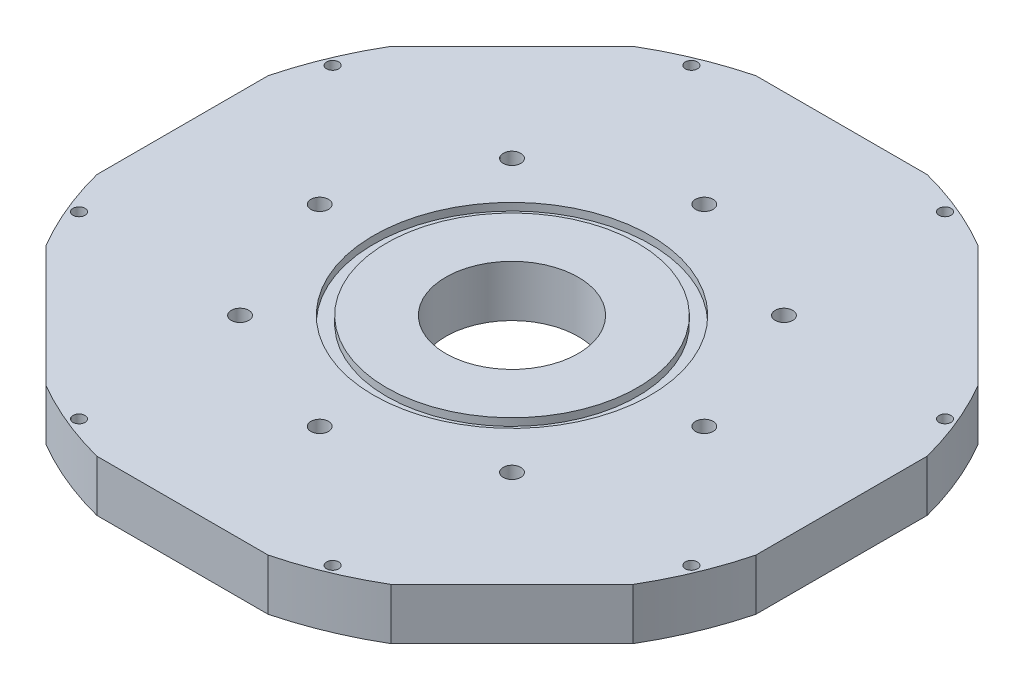
from build123d import *

# Parameters (mm, degrees)
BOSS_EXTRUDE1_DEPTH = 19.05
SKETCH3_R           = 24.5745
CUT_EXTRUDE1_DEPTH  = 175.004260005
SKETCH5_R           = 51.3715
SKETCH5_R_2         = 46.5455
CUT_EXTRUDE2_DEPTH  = 2.794
SKETCH19_R          = 2.2479
CUT_EXTRUDE4_DEPTH  = 175.004260005
CIRPATTERN2_COUNT   = 8
SKETCH37_R          = 119.0625
SKETCH37_R_2        = 115.2525
CUT_EXTRUDE7_DEPTH  = 2.667
CIRPATTERN4_COUNT   = 8


with BuildPart() as part:
    # Sketch1 → Boss-Extrude1 (new body)
    with BuildSketch(Plane(origin=(0, 0, 0), x_dir=(1, 0, 0), z_dir=(0, 1, 0))):
        with BuildLine():
            ThreePointArc((-31.793446259, 122.3), (-48.357791931, 116.746037126), (-63.997797892, 108.960520786))
            Line((-63.997797892, 108.960520786), (-108.960520786, 63.997797892))
            ThreePointArc((-108.960520786, 63.997797892), (-116.746037126, 48.357791931), (-122.3, 31.793446259))
            Line((-122.3, 31.793446259), (-122.3, -31.793446259))
            ThreePointArc((-122.3, -31.793446259), (-116.746037126, -48.357791931), (-108.960520786, -63.997797892))
            Line((-108.960520786, -63.997797892), (-63.997797892, -108.960520786))
            ThreePointArc((-63.997797892, -108.960520786), (-48.357791931, -116.746037126), (-31.793446259, -122.3))
            Line((-31.793446259, -122.3), (31.793446259, -122.3))
            ThreePointArc((31.793446259, -122.3), (48.357791931, -116.746037126), (63.997797892, -108.960520786))
            Line((63.997797892, -108.960520786), (108.960520786, -63.997797892))
            ThreePointArc((108.960520786, -63.997797892), (116.746037126, -48.357791931), (122.3, -31.793446259))
            Line((122.3, -31.793446259), (122.3, 31.793446259))
            ThreePointArc((122.3, 31.793446259), (116.746037126, 48.357791931), (108.960520786, 63.997797892))
            Line((108.960520786, 63.997797892), (63.997797892, 108.960520786))
            ThreePointArc((63.997797892, 108.960520786), (48.357791931, 116.746037126), (31.793446259, 122.3))
            Line((31.793446259, 122.3), (-31.793446259, 122.3))
        make_face()
    extrude(amount=BOSS_EXTRUDE1_DEPTH)

    # Sketch3 → Cut-Extrude1 (cut, through all)
    with BuildSketch(Plane(origin=(0, 19.05, 0), x_dir=(1, 0, 0), z_dir=(0, 1, 0))):
        Circle(SKETCH3_R)
    extrude(amount=-CUT_EXTRUDE1_DEPTH, mode=Mode.SUBTRACT)

    # Sketch5 → Cut-Extrude2 (cut)
    with BuildSketch(Plane(origin=(0, 19.05, 0), x_dir=(1, 0, 0), z_dir=(0, 1, 0))):
        Circle(SKETCH5_R)
        Circle(SKETCH5_R_2, mode=Mode.SUBTRACT)
    extrude(amount=-CUT_EXTRUDE2_DEPTH, mode=Mode.SUBTRACT)

    # Sketch19 → Cut-Extrude4 (cut, through all)
    with BuildSketch(Plane(origin=(0, 19.05, 0), x_dir=(1, 0, 0), z_dir=(0, 1, 0))):
        with Locations((-47.069870839, 113.636720559)):
            Circle(SKETCH19_R)
    cut_extrude4 = extrude(amount=-CUT_EXTRUDE4_DEPTH, mode=Mode.SUBTRACT)

    # CirPattern2: Cut-Extrude4 ×8 about axis
    cirpattern2_axis = Axis((0, 0, 0), (0, 1, 0))
    for i in range(1, CIRPATTERN2_COUNT):
        add(cut_extrude4.rotate(cirpattern2_axis, i * 360 / CIRPATTERN2_COUNT), mode=Mode.SUBTRACT)

    # Sketch23 → 5/16-18 Tapped Hole2 (revolve, cut)
    with BuildSketch(Plane(origin=(-71.374, 19.05, 0), x_dir=(0, 0, 1), z_dir=(1, 0, 0))):
        Polygon((0, 0), (0, 14.661148974), (3.2639, 12.7), (3.2639, 0), align=None)
    f_5_16_18_tapped_hole2 = revolve(axis=Axis((-71.374, 25.4, 0), (0, -1, 0)), mode=Mode.SUBTRACT)

    # Sketch37 → Cut-Extrude7 (cut)
    with BuildSketch(Plane.XZ):
        Circle(SKETCH37_R)
        Circle(SKETCH37_R_2, mode=Mode.SUBTRACT)
    extrude(amount=-CUT_EXTRUDE7_DEPTH, mode=Mode.SUBTRACT)

    # CirPattern4: 5/16-18 Tapped Hole2 ×8 about axis
    cirpattern4_axis = Axis((0, 0, 0), (0, 1, 0))
    for i in range(1, CIRPATTERN4_COUNT):
        add(f_5_16_18_tapped_hole2.rotate(cirpattern4_axis, i * 360 / CIRPATTERN4_COUNT), mode=Mode.SUBTRACT)


solid = part.part
